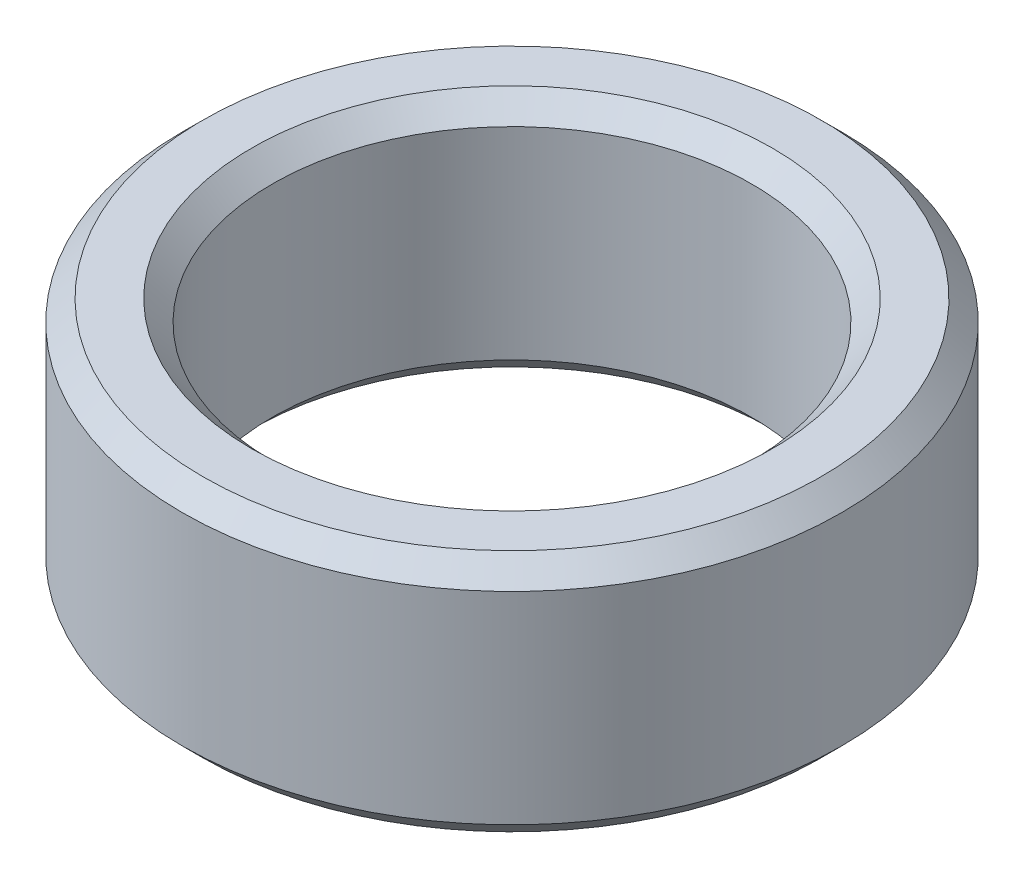
from build123d import *

# Parameters (mm, degrees)
SKETCH1_R           = 37.5
BOSS_EXTRUDE1_DEPTH = 27.692215675
SKETCH2_R           = 27.263559838
CUT_EXTRUDE1_DEPTH  = 60.827742804
CHAMFER1_SIZE       = 2.35433399


with BuildPart() as part:
    # Sketch1 → Boss-Extrude1 (new body)
    with BuildSketch(Plane(origin=(0, 0, 0), x_dir=(1, 0, 0), z_dir=(0, 1, 0))):
        Circle(SKETCH1_R)
    extrude(amount=BOSS_EXTRUDE1_DEPTH)

    # Sketch2 → Cut-Extrude1 (cut, through all)
    with BuildSketch(Plane(origin=(0, 0, 0), x_dir=(1, 0, 0), z_dir=(0, 1, 0))):
        Circle(SKETCH2_R)
    extrude(amount=CUT_EXTRUDE1_DEPTH, mode=Mode.SUBTRACT)

    # Chamfer1
    chamfer1_edges = [part.edges().sort_by_distance(p)[0] for p in [
        (-27.263559838, 27.692215675, 0),
        (-27.263559838, 0, 0),
        (-37.5, 0, 0),
        (-37.5, 27.692215675, 0),
    ]]
    chamfer(chamfer1_edges, length=CHAMFER1_SIZE)


solid = part.part
